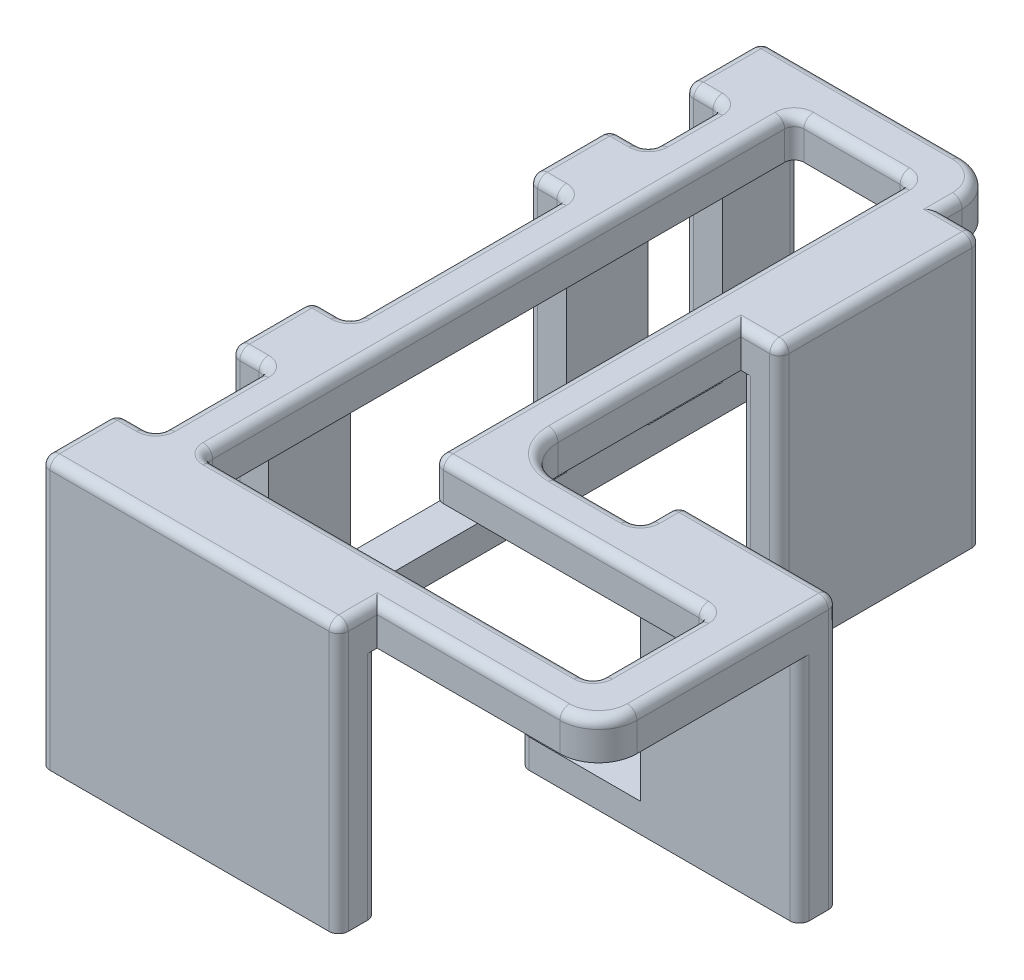
from build123d import *

# Parameters (mm, degrees)
BOSS_EXTRUDE1_DEPTH = 4
SKETCH2_W           = 16.55
SKETCH2_H           = 4
SKETCH2_W_2         = 4
SKETCH2_H_2         = 21
SKETCH2_H_3         = 8.5
SKETCH2_H_4         = 8
BOSS_EXTRUDE2_DEPTH = 24
FILLET2_R           = 4
BOSS_EXTRUDE3_DEPTH = 3
SKETCH7_R           = 1.6
BOSS_EXTRUDE4_DEPTH = 3
SKETCH8_W           = 5
SKETCH8_H           = 5
BOSS_EXTRUDE5_DEPTH = 3
SKETCH9_R           = 1.6
CUT_EXTRUDE1_DEPTH  = 3
CUT_EXTRUDE2_DEPTH  = 6
SKETCH11_W          = 4
SKETCH11_H          = 11.725
SKETCH11_H_2        = 7.725
CUT_EXTRUDE3_DEPTH  = 10
FILLET3_R           = 1
FILLET4_R           = 1
FILLET5_R           = 1
FILLET6_R           = 1


with BuildPart() as part:
    # Sketch1 → Boss-Extrude1 (new body)
    with BuildSketch(Plane(origin=(0, 0, 0), x_dir=(1, 0, 0), z_dir=(0, 1, 0))):
        Polygon((20.9, 20.9), (33.45, 20.9), (33.45, 24.9), (50, 24.9), (50, 0), (27, 0), (27, -4), (-4, -4), (-4, 19.725), (-4, 24.225), (0, 24.225), (0, 35.45), (0, 46.675), (-4, 46.675), (-4, 51.175), (-4, 70.9), (20.9, 70.9), (20.9, 64.9), (24.9, 64.9), (24.9, 43.9), (20.9, 43.9), align=None)
    extrude(amount=BOSS_EXTRUDE1_DEPTH)

    # Sketch2 → Boss-Extrude2 (add)
    with BuildSketch(Plane.XZ):
        Polygon((27, 0), (23, 0), (0, 0), (0, -4), (-4, -4), (-4, 4), (23, 4), (27, 4), align=None)
        with Locations((41.725, -22.9)):
            Rectangle(SKETCH2_W, SKETCH2_H)
        with Locations((22.9, -54.4)):
            Rectangle(SKETCH2_W_2, SKETCH2_H_2)
        with Locations((-2, -19.975)):
            Rectangle(SKETCH2_W_2, SKETCH2_H_3)
        with Locations((-2, -50.925)):
            Rectangle(SKETCH2_W_2, SKETCH2_H_3)
        with Locations((-2, -66.9)):
            Rectangle(SKETCH2_W_2, SKETCH2_H_4)
    extrude(amount=BOSS_EXTRUDE2_DEPTH)

    # Fillet2
    fillet2_edges = [part.edges().sort_by_distance(p)[0] for p in [
        (20.9, 2, -20.9),
        (50, 2, 0),
        (20.9, 2, -70.9),
    ]]
    fillet(fillet2_edges, radius=FILLET2_R)

    # Sketch5 → Boss-Extrude3 (add)
    with BuildSketch(Plane(origin=(0, -24, 0), x_dir=(-1, 0, 0), z_dir=(0, -1, 0))):
        Polygon((0, 19.725), (0, 0), (-27, 0), (-27, -4), (4, -4), (4, 51.175), (4, 70.9), (0, 70.9), align=None)
    extrude(amount=-BOSS_EXTRUDE3_DEPTH)

    # Sketch7 → Boss-Extrude4 (add)
    with BuildSketch(Plane.XZ.offset(24)):
        Polygon((24.9, -47.9), (24.9, -34.9), (24.9, -28.9), (28.9, -28.9), (28.9, -24.9), (33.45, -24.9), (37.45, -24.9), (37.45, -20.9), (20.9, -20.9), (20.9, -47.9), align=None)
        with Locations(Location((24.9, -24.9, 0), (0, 0, 270))):
            Circle(SKETCH7_R, mode=Mode.SUBTRACT)
    extrude(amount=-BOSS_EXTRUDE4_DEPTH)

    # Sketch8 → Boss-Extrude5 (add)
    with BuildSketch(Plane(origin=(0, -21, 0), x_dir=(1, 0, 0), z_dir=(0, 1, 0))):
        with Locations((-2.5, 13.225)):
            Rectangle(SKETCH8_W, SKETCH8_H)
        with Locations((-2.5, 57.675)):
            Rectangle(SKETCH8_W, SKETCH8_H)
    extrude(amount=-BOSS_EXTRUDE5_DEPTH)

    # Sketch9 → Cut-Extrude1 (cut)
    with BuildSketch(Plane(origin=(0, -21, 0), x_dir=(1, 0, 0), z_dir=(0, 1, 0))):
        with Locations(Location((-2.5, 57.675, 0), (0, 0, 270))):
            Circle(SKETCH9_R)
        with Locations(Location((-2.5, 13.225, 0), (0, 0, 270))):
            Circle(SKETCH9_R)
    extrude(amount=-CUT_EXTRUDE1_DEPTH, mode=Mode.SUBTRACT)

    # Sketch10 → Cut-Extrude2 (cut)
    with BuildSketch(Plane(origin=(0, 4, 0), x_dir=(1, 0, 0), z_dir=(0, 1, 0))):
        Polygon((10.45, 65.9), (16.45, 65.9), (16.45, 16.45), (45, 16.45), (45, 10.45), (45, 4.45), (4.45, 4.45), (4.45, 65.9), align=None)
    extrude(amount=-CUT_EXTRUDE2_DEPTH, mode=Mode.SUBTRACT)

    # Sketch11 → Cut-Extrude3 (cut)
    with BuildSketch(Plane(origin=(0, 0, 0), x_dir=(-1, 0, 0), z_dir=(0, -1, 0))):
        with Locations((2, 9.8625)):
            Rectangle(SKETCH11_W, SKETCH11_H)
        with Locations((2, 59.0375)):
            Rectangle(SKETCH11_W, SKETCH11_H_2)
    extrude(amount=-CUT_EXTRUDE3_DEPTH, mode=Mode.SUBTRACT)

    # Fillet3
    fillet3_edges = [part.edges().sort_by_distance(p)[0] for p in [
        (-4, -8.5, -15.725),
        (-4, -8.5, -55.175),
        (-4, -8.5, -62.9),
        (-4, -8.5, -4),
        (20.9, -10.5, -43.9),
        (20.9, -22.5, -20.9),
        (24.9, -8.5, -43.9),
        (33.45, 2, -20.9),
        (33.45, -8.5, -24.9),
        (50, -10, -24.9),
        (27, -10, 4),
        (-4, -10, 4),
        (-4, -8.5, -24.225),
        (0, 2, -24.225),
        (0, 2, -46.675),
        (-4, -8.5, -46.675),
        (-4, -10, -70.9),
        (24.9, -10, -64.9),
        (0, 2, -15.725),
        (0, 2, -4),
        (0, 2, -62.9),
        (0, 2, -55.175),
        (27, -12, 0),
        (50, -12, -20.9),
        (0, -12, -70.9),
        (20.9, -12, -64.9),
    ]]
    fillet(fillet3_edges, radius=FILLET3_R)

    # Fillet4
    fillet4_edges = [part.edges().sort_by_distance(p)[0] for p in [
        (22.4, 4, -43.9),
        (20.9, 4, -34.4),
        (28.675, 4, -20.9),
        (33.157106781, 4, -21.192893219),
        (33.45, 4, -22.9),
        (33.742893219, 4, -24.607106781),
        (41.725, 4, -24.9),
        (36.5, 4, 0),
        (27, 4, 1.5),
        (-3.707106781, 4, -3.707106781),
        (-2, 4, -4),
        (-0.292893219, 4, -4.292893219),
        (0, 4, -9.8625),
        (-0.292893219, 4, -15.432106781),
        (-2, 4, -15.725),
        (-3.707106781, 4, -16.017893219),
        (0, 4, -35.45),
        (-3.707106781, 4, -54.882106781),
        (-2, 4, -55.175),
        (-0.292893219, 4, -55.467893219),
        (0, 4, -59.0375),
        (-0.292893219, 4, -62.607106781),
        (-2, 4, -62.9),
        (-3.707106781, 4, -63.192893219),
        (10.45, 4, -65.9),
        (4.45, 4, -35.175),
        (30.725, 4, -16.45),
        (45, 4, -10.45),
        (24.725, 4, -4.45),
        (16.45, 4, -41.175),
        (16.45, 2, -65.9),
        (4.45, 2, -65.9),
        (4.45, 2, -4.45),
        (45, 2, -4.45),
        (45, 2, -16.45),
        (16.45, 2, -16.45),
        (20.9, 4, -65.9),
        (19.728427125, 4, -69.728427125),
        (-4, 4, 0),
        (24.9, 4, -54.4),
        (6.95, 4, -70.9),
        (11.5, 4, 4),
        (-3.707106781, 4, -70.607106781),
        (-3.707106781, 4, 3.707106781),
        (22.4, 4, -64.9),
        (24.607106781, 4, -64.607106781),
        (24.607106781, 4, -44.192893219),
        (22.071572875, 4, -22.071572875),
        (49.707106781, 4, -24.607106781),
        (50, 4, -13.95),
        (48.828427125, 4, -1.171572875),
        (26.707106781, 4, 3.707106781),
        (-2, 4, -46.675),
        (-3.707106781, 4, -46.967893219),
        (-2, 4, -24.225),
        (-3.707106781, 4, -23.932106781),
        (-0.292893219, 4, -46.382106781),
        (-0.292893219, 4, -24.517893219),
    ]]
    fillet(fillet4_edges, radius=FILLET4_R)

    # Fillet5
    fillet5_edges = [part.edges().sort_by_distance(p)[0] for p in [
        (-5, -22.5, -60.175),
        (-5, -22.5, -55.175),
        (-5, -22.5, -15.725),
        (-5, -22.5, -10.725),
    ]]
    fillet(fillet5_edges, radius=FILLET5_R - 0.0001)  # a hair under: the kernel refuses the full size

    # Fillet6
    fillet6_edges = [part.edges().sort_by_distance(p)[0] for p in [
        (24.9, -22.5, -28.9),
        (28.9, -22.5, -24.9),
        (28.9, -22.5, -28.9),
    ]]
    fillet(fillet6_edges, radius=FILLET6_R)


solid = part.part
